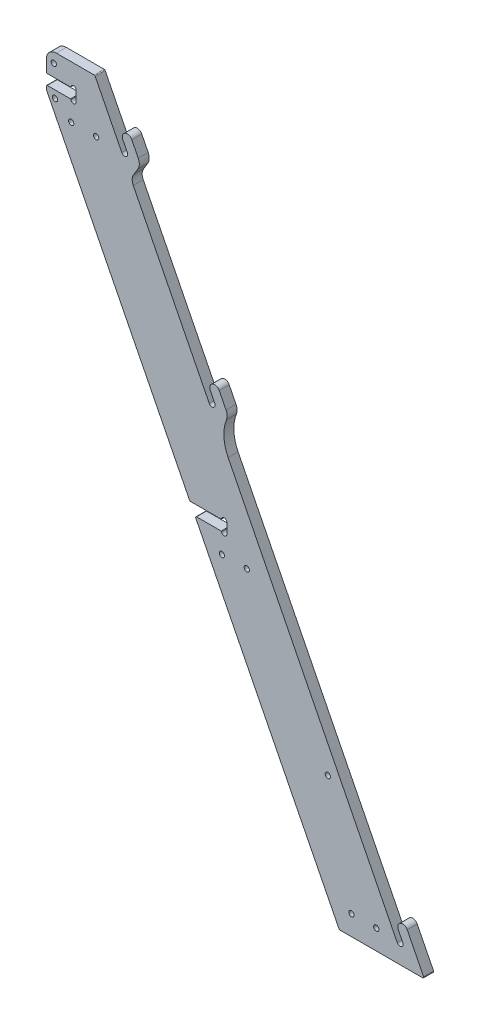
from build123d import *

# Parameters (mm, degrees)
BOSS_EXTRUDE1_DEPTH     = 12.7
SKETCH3_W               = 47.23204247
SKETCH3_H               = 13.081
CUT_EXTRUDE1_DEPTH      = 924.408729549
BOSS_EXTRUDE3_DEPTH     = 12.7
F_1_4_CLEARANCE_HOLE1_D = 6.7564
SKETCH13_W              = 23.41954247
SKETCH13_H              = 28.3464
CUT_EXTRUDE2_DEPTH      = 924.408729549
SKETCH14_R              = 3.429
CUT_EXTRUDE3_DEPTH      = 913.678476707
FILLET4_R               = 50.8
FILLET5_R               = 12.7
FILLET6_R               = 1.27
FILLET7_R               = 0.508
F_1_4_CLEARANCE_HOLE2_D = 6.7564
CUT_EXTRUDE4_DEPTH      = 913.678476707
FILLET8_R               = 1.27


with BuildPart() as part:
    # Sketch1 → Boss-Extrude1 (new body)
    with BuildSketch(Plane.XY):
        Polygon((0, 0), (-396.875, 787.4), (-482.20704247, 787.4), (-85.33204247, 0), align=None)
    extrude(amount=BOSS_EXTRUDE1_DEPTH)

    # Sketch3 → Cut-Extrude1 (cut, through all)
    with BuildSketch(Plane.XY.offset(12.7)):
        with Locations((-252.216021235, 371.4115)):
            Rectangle(SKETCH3_W, SKETCH3_H)
        with Locations((-444.303521235, 752.5131)):
            Rectangle(SKETCH3_W, SKETCH3_H)
    extrude(amount=-CUT_EXTRUDE1_DEPTH, mode=Mode.SUBTRACT)

    # Sketch10 → Boss-Extrude3 (add)
    with BuildSketch(Plane.XY.offset(12.7)):
        with BuildLine():
            Line((-244.024703128, 501.780299783), (-249.740869802, 513.121174464))
            ThreePointArc((-249.740869802, 513.121174464), (-246.928515798, 521.649695143), (-238.39999512, 518.837341139))
            Line((-238.39999512, 518.837341139), (-226.967661771, 496.155591775))
            Line((-226.967661771, 496.155591775), (-239.680416455, 475.525946247))
            Line((-239.680416455, 475.525946247), (-251.112749804, 498.207695611))
            ThreePointArc((-251.112749804, 498.207695611), (-245.78242438, 496.449974359), (-244.024703128, 501.780299783))
        make_face()
        with BuildLine():
            Line((-351.145666605, 696.673002545), (-362.577999954, 719.354751908))
            ThreePointArc((-362.577999954, 719.354751908), (-357.24767453, 717.597030656), (-355.489953278, 722.92735608))
            Line((-355.489953278, 722.92735608), (-361.206119952, 734.268230762))
            ThreePointArc((-361.206119952, 734.268230762), (-358.393765948, 742.79675144), (-349.86524527, 739.984397436))
            Line((-349.86524527, 739.984397436), (-338.432911921, 717.302648072))
            Line((-338.432911921, 717.302648072), (-351.145666605, 696.673002545))
        make_face()
        with BuildLine():
            Line((0, 0), (-11.432333349, 22.681749364))
            ThreePointArc((-11.432333349, 22.681749364), (-6.102007925, 20.924028111), (-4.344286673, 26.254353535))
            Line((-4.344286673, 26.254353535), (-10.060453347, 37.595228217))
            ThreePointArc((-10.060453347, 37.595228217), (-7.248099343, 46.123748895), (1.280421335, 43.311394892))
            Line((1.280421335, 43.311394892), (12.712754684, 20.629645528))
            Line((12.712754684, 20.629645528), (23.110761502, 0))
            Line((23.110761502, 0), (0, 0))
        make_face()
    extrude(amount=-BOSS_EXTRUDE3_DEPTH)

    # 1/4 Clearance Hole1 (through all)
    with Locations(Plane.XY.offset(12.7)):
        with Locations((-99.918593468, 162.967911886), (-427.0375, 720.5726), (-395.2875, 720.5726), (-203.2, 339.471), (-234.95, 339.471), (-69.85, 25.4), (-38.1, 25.4)):
            Hole(F_1_4_CLEARANCE_HOLE1_D / 2)

    # Sketch13 → Cut-Extrude2 (cut, through all)
    with BuildSketch(Plane.XY.offset(12.7)):
        with Locations((-470.497271235, 773.2268)):
            Rectangle(SKETCH13_W, SKETCH13_H)
    extrude(amount=-CUT_EXTRUDE2_DEPTH, mode=Mode.SUBTRACT)

    # Sketch14 → Cut-Extrude3 (cut, through all)
    with BuildSketch(Plane.XY.offset(12.7)):
        with Locations((-424.1165, 759.0536)):
            Circle(SKETCH14_R)
        with Locations((-424.1165, 745.9726)):
            Circle(SKETCH14_R)
        with Locations((-232.029, 377.952)):
            Circle(SKETCH14_R)
        with Locations((-232.029, 364.871)):
            Circle(SKETCH14_R)
    extrude(amount=-CUT_EXTRUDE3_DEPTH, mode=Mode.SUBTRACT)

    # Fillet4
    # the kernel refuses this fillet: 50.8 mm, written as the material it adds along each edge
    with BuildSketch(Plane(origin=(-239.680416455, 475.525946247, 12.7), x_dir=(0.45009186412240076, -0.8929822584188458, 0), z_dir=(0, 0, -1))) as fillet4_piece_1:
        with BuildLine():
            CenterArc((28.176198377, -50.8), FILLET4_R, 90, 53.576426358)
            Line((-12.7, -20.6375), (-13.517523968, -20.03425))
            ThreePointArc((-13.517523968, -20.03425), (-7.21528485, -9.786267016), (-0.86528485, 0.532482984))
            Line((-0.86528485, 0.532482984), (0, 1.016))
            Line((0, 1.016), (28.176198377, 1.016))
            Line((28.176198377, 1.016), (28.176198377, 0))
        make_face()
    extrude(amount=12.7)

    # Fillet5
    fillet5_edges = [part.edges().sort_by_distance(p)[0] for p in [
        (-458.7875, 787.4, 6.35),
        (-226.967661771, 496.155591775, 6.35),
        (-338.432911921, 717.302648072, 6.35),
        (-351.145666605, 696.673002545, 6.35),
    ]]
    fillet(fillet5_edges, radius=FILLET5_R)

    # Fillet6
    fillet6_edges = [part.edges().sort_by_distance(p)[0] for p in [
        (-458.7875, 759.0536, 6.35),
        (-269.238796502, 364.871, 6.35),
        (-275.83204247, 377.952, 6.35),
    ]]
    fillet(fillet6_edges, radius=FILLET6_R)

    # Fillet7
    fillet7_edges = [part.edges().sort_by_distance(p)[0] for p in [
        (-235.458, 377.952, 6.35),
        (-427.5455, 759.0536, 6.35),
        (-427.5455, 745.9726, 6.35),
        (-235.458, 364.871, 6.35),
    ]]
    fillet(fillet7_edges, radius=FILLET7_R)

    # 1/4 Clearance Hole2 (through all)
    with Locations(Plane.XY.offset(12.7)):
        with Locations((-447.675, 736.6), (-449.2625, 774.7)):
            Hole(F_1_4_CLEARANCE_HOLE2_D / 2)

    # Sketch18 → Cut-Extrude4 (cut, through all)
    with BuildSketch(Plane.XY.offset(12.7)):
        Polygon((-458.7875, 745.9726), (-458.7875, 740.93562774), (-461.326296502, 745.9726), align=None)
    extrude(amount=-CUT_EXTRUDE4_DEPTH, mode=Mode.SUBTRACT)

    # Fillet8
    fillet8_edges = [part.edges().sort_by_distance(p)[0] for p in [
        (-458.7875, 745.9726, 6.35),
        (-458.7875, 740.93562774, 6.35),
        (-85.33204247, 0, 6.35),
        (23.110761502, 0, 6.35),
        (-396.875, 787.4, 6.35),
    ]]
    fillet(fillet8_edges, radius=FILLET8_R)


solid = part.part
